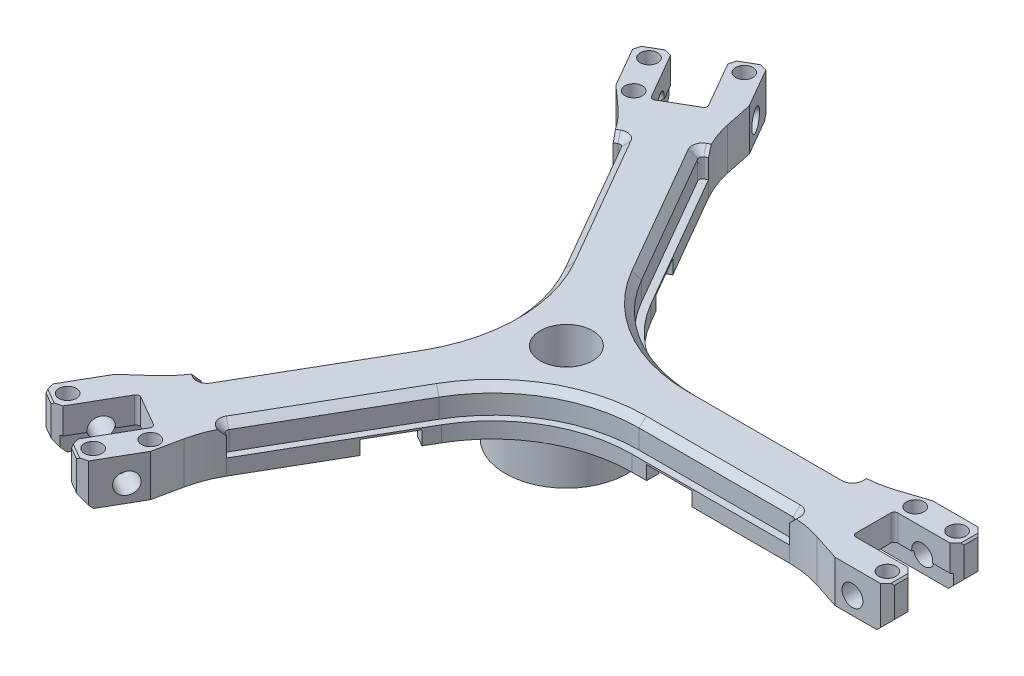
from build123d import *

# Parameters (mm, degrees)
SKETCH12_W            = 17.5
SKETCH12_H            = 11
BOSS_EXTRUDE1_DEPTH   = 12
CIRPATTERN1_COUNT     = 3
FILLET1_R             = 40
CUT_EXTRUDE1_START    = -7.5
CUT_EXTRUDE1_DEPTH    = 7.5
CIRPATTERN2_COUNT     = 3
CUT_EXTRUDE2_DEPTH    = 4.5
CIRPATTERN3_COUNT     = 3
SKETCH7_R             = 3.0000000000000084
CUT_EXTRUDE3_DEPTH    = 147.718034676096
CIRPATTERN4_COUNT     = 3
SKETCH13_W            = 4.60102051443364
SKETCH13_H            = 2
CUT_EXTRUDE4_DEPTH    = 6.8
SKETCH8_R             = 2.500000000000009
SKETCH8_R_2           = 2.4999999999999942
SKETCH8_R_3           = 2.499999999999995
CUT_EXTRUDE5_DEPTH    = 5
CIRPATTERN5_COUNT     = 3
SKETCH9A_W            = 13
SKETCH9A_H            = 4.000000000000002
CUT_EXTRUDE6_DEPTH    = 147.718034676096
CIRPATTERN6_COUNT     = 3
M4X0_7_TAPPED_HOLE1_D = 3.3
CIRPATTERN7_COUNT     = 3
FILLET2_R             = 1
CHAMFER1_SIZE         = 3
CHAMFER2_SIZE         = 2
CHAMFER3_SIZE         = 1
CHAMFER4_SIZE         = 0.5


# Some blends are built 0.0001 mm under size
with BuildPart() as part:
    # Sketch12 → Revolve1 (revolve)
    with BuildSketch(Plane.XY, mode=Mode.PRIVATE) as revolve1_sk:
        with Locations((8.75, 5.5)):
            Rectangle(SKETCH12_W, SKETCH12_H)
    revolve(revolve1_sk.sketch.rotate(Axis((0, -4.175541286487158, 0), (0, 1, 0)), 90), axis=Axis((0, -4.175541286487158, 0), (0, 1, 0)))

    # Sketch2 → Boss-Extrude1 (add)
    with BuildSketch(Plane(origin=(0, 11, 0), x_dir=(1, 0, 0), z_dir=(0, 1, 0))):
        with BuildLine():
            Line((0, 0), (5.773502691896228, 9.999999999999998))
            Line((5.773502691896228, 9.999999999999998), (74.00000000000001, 9.999999999999998))
            ThreePointArc((74.00000000000001, 9.999999999999998), (78.72823381955126, 10.374946330046054), (83.33827871121983, 11.490413003489888))
            Line((83.33827871121983, 11.490413003489888), (91, 13.999999999999996))
            Line((91, 13.999999999999996), (106, 13.999999999999996))
            Line((106, 13.999999999999996), (106, 6))
            Line((106, 6), (88, 6))
            Line((88, 6), (88, -6))
            Line((88, -6), (106, -6))
            Line((106, -6), (106, -13.999999999999996))
            Line((106, -13.999999999999996), (91, -13.999999999999996))
            Line((91, -13.999999999999996), (83.33827871121983, -11.490413003489888))
            ThreePointArc((83.33827871121983, -11.490413003489888), (78.72823381955126, -10.374946330046058), (74.00000000000001, -10.000000000000002))
            Line((74.00000000000001, -10.000000000000002), (5.773502691896228, -10))
            Line((5.773502691896228, -10), (0, 0))
        make_face()
    boss_extrude1 = extrude(amount=BOSS_EXTRUDE1_DEPTH)

    # CirPattern1: Boss-Extrude1 ×3 about axis
    cirpattern1_axis = Axis((3.1e-16, 0, -1.23e-15), (0, 1, 0))
    for i in range(1, CIRPATTERN1_COUNT):
        add(boss_extrude1.rotate(cirpattern1_axis, i * 360 / CIRPATTERN1_COUNT))

    # Fillet1
    # the kernel refuses this fillet: 40 mm, written as the material it adds along each edge
    with BuildSketch(Plane(origin=(5.773502691896228, 11, 10), x_dir=(-0.4999999999999998, 0, 0.8660254037844387), z_dir=(0, 1, 0))) as fillet1_piece_1:
        with BuildLine():
            CenterArc((FILLET1_R * 0.57735026919, FILLET1_R), FILLET1_R, 210, 59.99999999999994)
            Line((-FILLET1_R * 0.288675134595, FILLET1_R * 0.5), (0, 0))
            Line((0, 0), (FILLET1_R * 0.57735026919, 8.9e-16))
        make_face()
    extrude(amount=12)
    with BuildSketch(Plane(origin=(5.773502691896228, 11, -9.999999999999998), x_dir=(-0.49999999999999833, 0, -0.8660254037844396), z_dir=(0, 1, 0))) as fillet1_piece_2:
        with BuildLine():
            CenterArc((FILLET1_R * 0.57735026919, -FILLET1_R), FILLET1_R, 90.00000000000009, 59.99999999999997)
            Line((-FILLET1_R * 0.288675134595, -FILLET1_R * 0.5), (0, 0))
            Line((0, 0), (FILLET1_R * 0.57735026919, -4.4e-16))
        make_face()
    extrude(amount=12)
    with BuildSketch(Plane(origin=(-11.547005383792497, 11, 2.152e-14), x_dir=(-0.5000000000000001, 0, -0.8660254037844386), z_dir=(0, 1, 0))) as fillet1_piece_3:
        with BuildLine():
            CenterArc((FILLET1_R * 0.57735026919, FILLET1_R), FILLET1_R, 209.99999999999997, 60)
            Line((-FILLET1_R * 0.288675134595, FILLET1_R * 0.5), (0, 0))
            Line((0, 0), (FILLET1_R * 0.57735026919, -4.4e-16))
        make_face()
    extrude(amount=12)

    # Sketch4 → Cut-Extrude1 (cut)
    with BuildSketch(Plane(origin=(0, 23, 0), x_dir=(1, 0, 0), z_dir=(0, 1, 0)).offset(CUT_EXTRUDE1_START)):
        with BuildLine():
            Line((-28.339745962154975, -69.08587988004874), (-5.773502691896136, -30.000000000000323))
            ThreePointArc((-5.773502691896136, -30.000000000000323), (8.867513459481433, -15.35898384862255), (28.867513459481593, -10))
            Line((28.867513459481593, -10), (74.00000000000001, -10.000000000000002))
            Line((74.00000000000001, -10.000000000000002), (74.00000000000001, -8))
            Line((74.00000000000001, -8), (28.867513459481597, -8.000000000000007))
            ThreePointArc((28.867513459481597, -8.000000000000007), (7.8675134594814295, -13.626933041053682), (-7.505553499465017, -29.000000000000327))
            Line((-7.505553499465017, -29.000000000000327), (-30.07179676972386, -68.08587988004875))
            Line((-30.07179676972386, -68.08587988004875), (-28.339745962154975, -69.08587988004874))
        make_face()
    cut_extrude1 = extrude(amount=CUT_EXTRUDE1_DEPTH, mode=Mode.SUBTRACT)

    # CirPattern2: Cut-Extrude1 ×3 about axis
    cirpattern2_axis = Axis((2.23e-15, 0, -3.1e-15), (0, 1, 0))
    for i in range(1, CIRPATTERN2_COUNT):
        add(cut_extrude1.rotate(cirpattern2_axis, i * 360 / CIRPATTERN2_COUNT), mode=Mode.SUBTRACT)

    # Sketch5 → Cut-Extrude2 (cut)
    with BuildSketch(Plane.XZ.offset(-11)):
        with BuildLine():
            Line((26.50000000000001, 6.5), (106, 6.5))
            Line((106, 6.5), (106, -6.5))
            Line((106, -6.5), (26.50000000000001, -6.5))
            ThreePointArc((26.50000000000001, -6.5), (20.00000000000001, 8e-16), (26.50000000000001, 6.5))
        make_face()
    cut_extrude2 = extrude(amount=-CUT_EXTRUDE2_DEPTH, mode=Mode.SUBTRACT)

    # CirPattern3: Cut-Extrude2 ×3 about axis
    cirpattern3_axis = Axis((-1.25e-15, 0, -4.9e-16), (0, 1, 0))
    for i in range(1, CIRPATTERN3_COUNT):
        add(cut_extrude2.rotate(cirpattern3_axis, i * 360 / CIRPATTERN3_COUNT), mode=Mode.SUBTRACT)

    # Sketch6 → Cut-Revolve1 (revolve, cut)
    with BuildSketch(Plane.XY, mode=Mode.PRIVATE) as cut_revolve1_sk:
        Polygon((0, 0), (3e-16, 23), (7.500000000000001, 23), (7.500000000000002, 12.499999999999998), (5.000000000000002, 12.499999999999998), (5.000000000000003, 4.499999999999999), (7.5000000000000036, 4.499999999999999), (7.5000000000000036, 0), align=None)
    revolve(cut_revolve1_sk.sketch.rotate(Axis((0, 25.442380660497697, 0), (0, -1, 0)), 90), axis=Axis((0, 25.442380660497697, 0), (0, -1, 0)), mode=Mode.SUBTRACT)

    # Sketch7 → Cut-Extrude3 (cut, symmetric)
    with BuildSketch(Plane.XY):
        with Locations((96, 16)):
            Circle(SKETCH7_R)
    cut_extrude3 = extrude(amount=CUT_EXTRUDE3_DEPTH, both=True, mode=Mode.SUBTRACT)

    # CirPattern4: Cut-Extrude3 ×3 about axis
    cirpattern4_axis = Axis((0, -4.175541286487158, 0), (0, -1, 0))
    for i in range(1, CIRPATTERN4_COUNT):
        add(cut_extrude3.rotate(cirpattern4_axis, i * 360 / CIRPATTERN4_COUNT), mode=Mode.SUBTRACT)

    # Sketch13 → Cut-Extrude4 (cut)
    with BuildSketch(Plane.XZ):
        with Locations((7.1994897427831805, 0)):
            Rectangle(SKETCH13_W, SKETCH13_H)
    extrude(amount=-CUT_EXTRUDE4_DEPTH, mode=Mode.SUBTRACT)

    # Sketch8 → Cut-Extrude5 (cut)
    with BuildSketch(Plane(origin=(0, 23, 0), x_dir=(1, 0, 0), z_dir=(0, 1, 0))):
        with Locations(Location((102, -10, 0), (0, 0, 270))):
            Circle(SKETCH8_R)
        with Locations(Location((102, 10, 0), (0, 0, 270))):
            Circle(SKETCH8_R_2)
        with Locations(Location((90, 10, 0), (0, 0, 270))):
            Circle(SKETCH8_R_3)
    cut_extrude5 = extrude(amount=-CUT_EXTRUDE5_DEPTH, mode=Mode.SUBTRACT)

    # CirPattern5: Cut-Extrude5 ×3 about axis
    cirpattern5_axis = Axis((-6.32e-15, 0, -5.6e-15), (0, 1, 0))
    for i in range(1, CIRPATTERN5_COUNT):
        add(cut_extrude5.rotate(cirpattern5_axis, i * 360 / CIRPATTERN5_COUNT), mode=Mode.SUBTRACT)

    # Sketch9a → Cut-Extrude6 (cut, symmetric)
    with BuildSketch(Plane.XY):
        with Locations((39.5, 13)):
            Rectangle(SKETCH9A_W, SKETCH9A_H)
    cut_extrude6 = extrude(amount=CUT_EXTRUDE6_DEPTH, both=True, mode=Mode.SUBTRACT)

    # CirPattern6: Cut-Extrude6 ×3 about axis
    cirpattern6_axis = Axis((-6.94e-15, 0, 8.01e-15), (0, 1, 0))
    for i in range(1, CIRPATTERN6_COUNT):
        add(cut_extrude6.rotate(cirpattern6_axis, i * 360 / CIRPATTERN6_COUNT), mode=Mode.SUBTRACT)

    # M4x0.7 Tapped Hole1 (through all)
    with Locations(Plane(origin=(0, 18, 0), x_dir=(-1, 0, 0), z_dir=(0, 1, 0))):
        with Locations((-102, 10), (-102, -10), (-90, -10)):
            m4x0_7_tapped_hole1 = Hole(M4X0_7_TAPPED_HOLE1_D / 2)

    # CirPattern7: M4x0.7 Tapped Hole1 ×3 about axis
    cirpattern7_axis = Axis((-6.32e-15, 0, -5.6e-15), (0, 1, 0))
    for i in range(1, CIRPATTERN7_COUNT):
        add(m4x0_7_tapped_hole1.rotate(cirpattern7_axis, i * 360 / CIRPATTERN7_COUNT), mode=Mode.SUBTRACT)

    # Fillet2
    fillet2_edges = [part.edges().sort_by_distance(p)[0] for p in [
        (9.5, 3.4, -1),
        (9.5, 3.4, 1),
        (74.00000000000001, 19.25, 8),
        (-38.80384757729341, 19.25, 79.21023553303058),
        (-49.196152422706675, 19.25, 73.21023553303058),
        (-30.07179676972386, 19.25, 68.08587988004875),
        (-43.92820323027555, 19.25, 60.085879880048445),
        (-43.92820323027604, 19.25, -60.08587988004809),
        (-49.19615242270662, 19.25, -73.21023553303061),
        (-38.803847577293354, 19.25, -79.21023553303061),
        (-30.071796769724475, 19.25, -68.08587988004848),
        (73.99999999999994, 19.25, -8.000000000000679),
        (88, 19.25, 6),
        (88, 19.25, -6),
    ]]
    fillet(fillet2_edges, radius=FILLET2_R - 0.0001)  # a hair under: the kernel refuses the full size

    # Chamfer1
    # the kernel refuses this chamfer: 3 mm, written as the material it takes off along each edge
    with BuildSketch(Plane(origin=(106, 11, -1.2150489638977344), x_dir=(0.02749587661058678, 0.9996219169112968, 0), z_dir=(0, 0, 1))) as chamfer1_piece_1:
        Polygon((CHAMFER1_SIZE * 0.999621916911, CHAMFER1_SIZE * 0.0274958766106), (-CHAMFER1_SIZE * 0.0274958766106, CHAMFER1_SIZE * 0.999621916911), (0, 0), align=None)
    extrude(amount=22.930097927795465, mode=Mode.SUBTRACT)
    with BuildSketch(Plane(origin=(106, 11, -21.715048963897722), x_dir=(-0.9996219169112968, -0.027495876610586317, 0), z_dir=(0, 0, 1))) as chamfer1_piece_2:
        Polygon((CHAMFER1_SIZE * 0.999621916911, -CHAMFER1_SIZE * 0.0274958766106), (-CHAMFER1_SIZE * 0.0274958766106, -CHAMFER1_SIZE * 0.999621916911), (0, 0), align=None)
    extrude(amount=22.930097927795458, mode=Mode.SUBTRACT)
    with BuildSketch(Plane(origin=(-71.80578404715838, 11, -80.94116831920164), x_dir=(-0.013747938305293366, 0.9996219169112968, -0.023812127644090495), z_dir=(0.8660254037844388, 0, -0.4999999999999998))) as chamfer1_piece_3:
        Polygon((CHAMFER1_SIZE * 0.999621916911, CHAMFER1_SIZE * 0.0274958766106), (-CHAMFER1_SIZE * 0.0274958766106, CHAMFER1_SIZE * 0.999621916911), (0, 0), align=None)
    extrude(amount=22.930097927795487, mode=Mode.SUBTRACT)
    with BuildSketch(Plane(origin=(-34.194215952841674, 11, 102.65621728309934), x_dir=(-0.01374793830529396, 0.9996219169112968, 0.02381212764409148), z_dir=(-0.8660254037844384, 0, -0.5000000000000004))) as chamfer1_piece_4:
        Polygon((CHAMFER1_SIZE * 0.999621916911, CHAMFER1_SIZE * 0.0274958766106), (-CHAMFER1_SIZE * 0.0274958766106, CHAMFER1_SIZE * 0.999621916911), (0, 0), align=None)
    extrude(amount=22.930097927795455, mode=Mode.SUBTRACT)
    with BuildSketch(Plane(origin=(-54.052263269577374, 11, -91.19116831920165), x_dir=(0.49981095845564805, -0.027495876610586296, 0.8656979742248804), z_dir=(0.8660254037844388, 0, -0.4999999999999998))) as chamfer1_piece_5:
        Polygon((CHAMFER1_SIZE * 0.999621916911, -CHAMFER1_SIZE * 0.0274958766106), (-CHAMFER1_SIZE * 0.0274958766106, -CHAMFER1_SIZE * 0.999621916911), (0, 0), align=None)
    extrude(amount=22.930097927795448, mode=Mode.SUBTRACT)
    with BuildSketch(Plane(origin=(-51.947736730422655, 11, 92.40621728309934), x_dir=(-0.01374793830529396, 0.9996219169112968, 0.02381212764409148), z_dir=(-0.8660254037844384, 0, -0.5000000000000004))) as chamfer1_piece_6:
        Polygon((CHAMFER1_SIZE * 0.999621916911, CHAMFER1_SIZE * 0.0274958766106), (-CHAMFER1_SIZE * 0.0274958766106, CHAMFER1_SIZE * 0.999621916911), (0, 0), align=None)
    extrude(amount=22.930097927795455, mode=Mode.SUBTRACT)

    # Chamfer2
    chamfer2_edges = [part.edges().sort_by_distance(p)[0] for p in [
        (-65.12435565298213, 18.499999999999556, -84.79869280115051),
        (-58.19615242270662, 19.25, -88.79869280115051),
        (-47.803847577293354, 19.25, -94.79869280115051),
        (-40.87564434701785, 18.499999999999556, -98.79869280115051),
        (-40.87564434701792, 18.499999999999556, 98.79869280115047),
        (-47.80384757729342, 19.25, 94.79869280115047),
        (-58.19615242270668, 19.25, 88.79869280115047),
        (-65.12435565298219, 18.499999999999556, 84.79869280115047),
        (106, 18.499999999999556, -13.999999999999996),
        (106, 19.25, -6),
        (106, 19.25, 6),
        (106, 18.499999999999556, 13.999999999999996),
        (73.99999999999993, 23, -9.499950000000673),
        (-28.772801965318006, 23, -68.83585488004847),
        (73.70713607050837, 23, -8.292863929492245),
        (-29.671737202186858, 23, -67.97868424200243),
        (50.93380672974073, 23, -8.000000000000462),
        (7.867513459481317, 23, -13.626933041053757),
        (-18.538700134594873, 23, -48.10997053940235),
        (-45.227198034682516, 23, -59.33590488004807),
        (-45.227198034682026, 23, 59.33590488004844),
        (-44.03539886832208, 23, -59.68582031251046),
        (-44.035398868321586, 23, 59.68582031251081),
        (-32.39510659514626, 23, -40.10997053940205),
        (-15.73502691896274, 23, 5.736e-14),
        (-32.395106595145926, 23, 40.109970539402305),
        (-28.772801965317377, 23, 68.83585488004874),
        (74.00000000000001, 23, 9.499950000000002),
        (-29.67173720218624, 23, 67.9786842420027),
        (73.70713607050844, 23, 8.292863929491572),
        (-18.538700134594443, 23, 48.109970539402504),
        (7.867513459481433, 23, 13.626933041053682),
        (50.93380672974081, 23, 8.000000000000004),
    ]]
    chamfer(chamfer2_edges, length=CHAMFER2_SIZE)

    # Chamfer3
    chamfer3_edges = [part.edges().sort_by_distance(p)[0] for p in [
        (-7.5000000000000036, 0, -8.282e-14),
    ]]
    chamfer(chamfer3_edges, length=CHAMFER3_SIZE)

    # Chamfer4
    chamfer4_edges = [part.edges().sort_by_distance(p)[0] for p in [
        (-61.660254037844446, 23, 86.79869280115045),
        (-44.33974596215567, 23, 96.79869280115047),
        (106, 23, 9.999999999999991),
        (106, 23, -10.000000000000002),
        (-44.339745962155604, 23, -96.79869280115051),
        (-61.66025403784435, 23, -86.79869280115052),
    ]]
    chamfer(chamfer4_edges, length=CHAMFER4_SIZE)


solid = part.part
